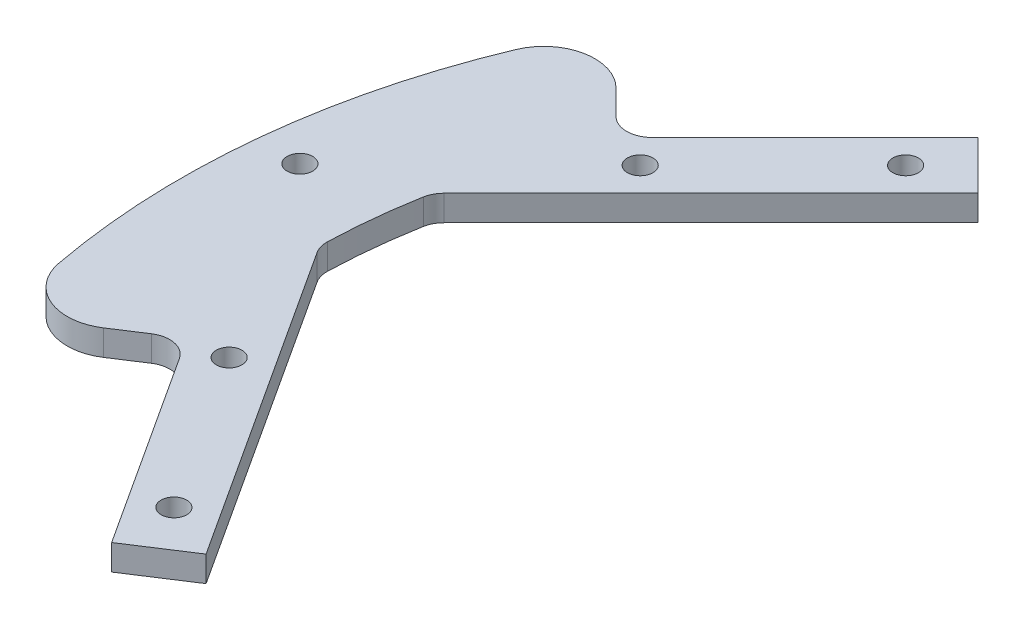
from build123d import *

# Parameters (mm, degrees)
SKETCH1_R           = 1.5
BOSS_EXTRUDE1_DEPTH = 3
FILLET1_R           = 6
FILLET2_R           = 3
CUT_EXTRUDE1_REACH  = 101.126
SKETCH2_R           = 1.5


with BuildPart() as part:
    # Sketch1 → Boss-Extrude1 (new body)
    with BuildSketch(Plane(origin=(0, 0, 0), x_dir=(1, 0, 0), z_dir=(0, 1, 0))):
        with BuildLine():
            Line((-74.629040009, 40.687914512), (-63.639610307, 29.69848481))
            Line((-63.639610307, 29.69848481), (-42.426406871, 50.911688245))
            Line((-42.426406871, 50.911688245), (-36.769552622, 45.254833996))
            Line((-36.769552622, 45.254833996), (-68.72500623, 13.299380388))
            ThreePointArc((-68.72500623, 13.299380388), (-69.616532676, 7.316992429), (-69.988296617, 1.279975229))
            Line((-69.988296617, 1.279975229), (-45.375058731, -36.621087439))
            Line((-45.375058731, -36.621087439), (-52.084423274, -40.978199719))
            Line((-52.084423274, -40.978199719), (-68.423594325, -15.81808268))
            Line((-68.423594325, -15.81808268), (-81.457709532, -24.282536066))
            ThreePointArc((-81.457709532, -24.282536066), (-84.534361106, 8.884919378), (-74.629040009, 40.687914512))
        make_face()
        with Locations((-43.840620434, 43.840620434)):
            Circle(SKETCH1_R, mode=Mode.SUBTRACT)
        with Locations((-59.39696962, 28.284271247)):
            Circle(SKETCH1_R, mode=Mode.SUBTRACT)
        with Locations((-51.997575213, -33.767620171)):
            Circle(SKETCH1_R, mode=Mode.SUBTRACT)
        with Locations((-63.979633983, -15.316867676)):
            Circle(SKETCH1_R, mode=Mode.SUBTRACT)
    extrude(amount=BOSS_EXTRUDE1_DEPTH)

    # Fillet1
    fillet1_edges = [part.edges().sort_by_distance(p)[0] for p in [
        (-74.629040009, 1.5, -40.687914512),
        (-81.457709532, 1.5, 24.282536066),
    ]]
    fillet(fillet1_edges, radius=FILLET1_R)

    # Fillet2
    fillet2_edges = [part.edges().sort_by_distance(p)[0] for p in [
        (-69.988296617, 1.5, -1.279975229),
        (-68.72500623, 1.5, -13.299380388),
        (-63.639610307, 1.5, -29.69848481),
        (-68.423594325, 1.5, 15.81808268),
    ]]
    fillet(fillet2_edges, radius=FILLET2_R)

    # Sketch2 → Cut-Extrude1 (cut, up to next)
    with BuildSketch(Plane(origin=(0, 3, 0), x_dir=(1, 0, 0), z_dir=(0, 1, 0)), mode=Mode.PRIVATE) as cut_extrude1_sk1:
        with Locations((-79.5, 8.5)):
            Circle(SKETCH2_R)
    cut_extrude1_tool1 = extrude(cut_extrude1_sk1.sketch, amount=-CUT_EXTRUDE1_REACH, mode=Mode.PRIVATE) & part.part
    add(cut_extrude1_tool1.solids().sort_by_distance((-79.5, 3, -8.5))[0], mode=Mode.SUBTRACT)


solid = part.part
